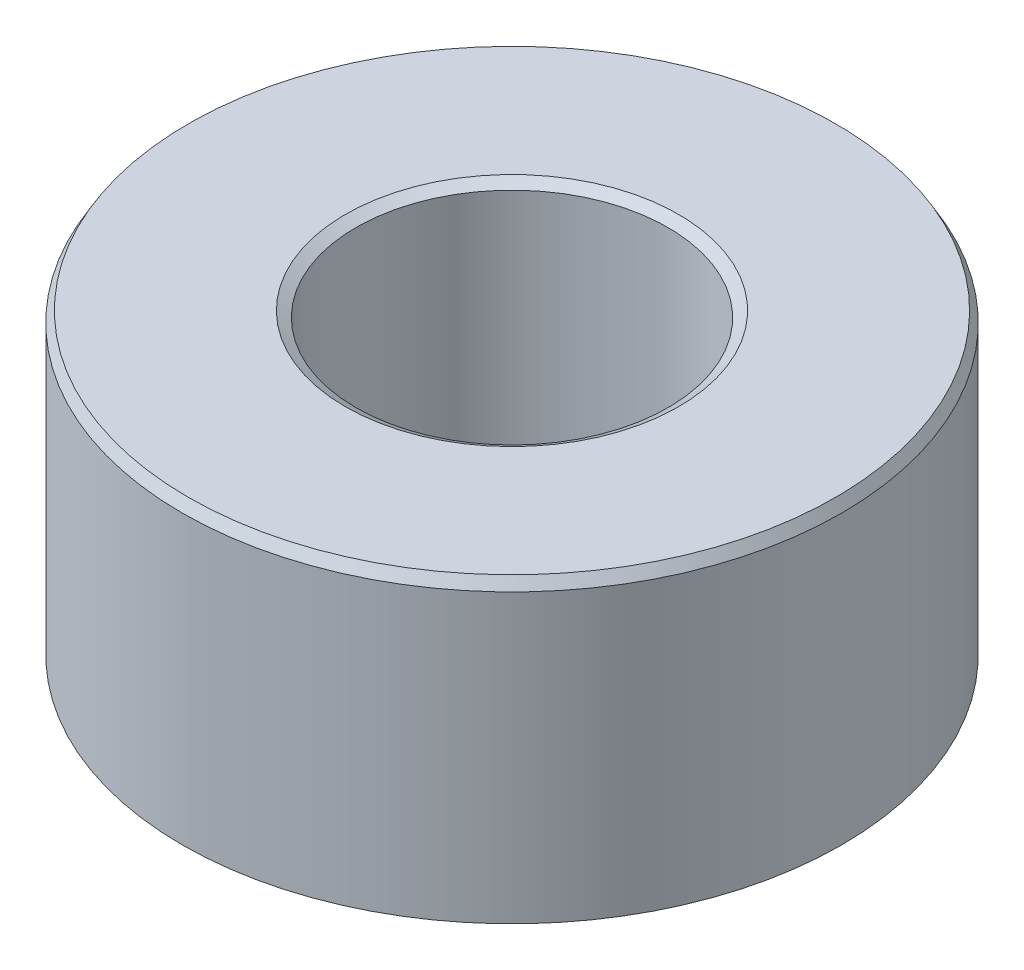
from build123d import *
from OCP.BRepFilletAPI import BRepFilletAPI_MakeChamfer

# Parameters (mm, degrees)
SKETCH1_R           = 7.5
BOSS_EXTRUDE1_DEPTH = 6.916963817
SKETCH2_R           = 3.549956279
CUT_EXTRUDE1_DEPTH  = 13.662716472
CHAMFER1_SIZE       = 0.240414175
CHAMFER1_SIZE2      = 0.138803189


with BuildPart() as part:
    # Sketch1 → Boss-Extrude1 (new body)
    with BuildSketch(Plane(origin=(0, 0, 0), x_dir=(1, 0, 0), z_dir=(0, 1, 0))):
        Circle(SKETCH1_R)
    extrude(amount=BOSS_EXTRUDE1_DEPTH)

    # Sketch2 → Cut-Extrude1 (cut, through all)
    with BuildSketch(Plane(origin=(0, 0, 0), x_dir=(1, 0, 0), z_dir=(0, 1, 0))):
        Circle(SKETCH2_R)
    extrude(amount=CUT_EXTRUDE1_DEPTH, mode=Mode.SUBTRACT)

    # Chamfer1: one chamfer whose edges measure the first distance from different faces: ONE call of the kernel's chamfer builder (chamfer() names one face for all edges)
    chamfer1_edges_1 = [part.edges().sort_by_distance(p)[0] for p in [
        (-3.549956279, 6.916963817, 0),
    ]]
    chamfer1_side_1 = [part.faces().sort_by_distance(p)[0] for p in [
        (-7.287867966, 6.916963817, 0),
    ]]
    chamfer1_edges_2 = [part.edges().sort_by_distance(p)[0] for p in [
        (-3.549956279, 0, 0),
    ]]
    chamfer1_side_2 = [part.faces().sort_by_distance(p)[0] for p in [
        (-3.549956279, 3.458481908, 0),
    ]]
    chamfer1_edges_3 = [part.edges().sort_by_distance(p)[0] for p in [
        (-7.5, 0, 0),
    ]]
    chamfer1_side_3 = [part.faces().sort_by_distance(p)[0] for p in [
        (-7.287867966, 0, 0),
    ]]
    chamfer1_edges_4 = [part.edges().sort_by_distance(p)[0] for p in [
        (-7.5, 6.916963817, 0),
    ]]
    chamfer1_side_4 = [part.faces().sort_by_distance(p)[0] for p in [
        (-7.5, 3.458481908, 0),
    ]]
    chamfer1 = BRepFilletAPI_MakeChamfer(part.part.solid().wrapped)
    for e in chamfer1_edges_1:
        chamfer1.Add(CHAMFER1_SIZE, CHAMFER1_SIZE2, e.wrapped, chamfer1_side_1[0].wrapped)  # the first distance lies on this face
    for e in chamfer1_edges_2:
        chamfer1.Add(CHAMFER1_SIZE, CHAMFER1_SIZE2, e.wrapped, chamfer1_side_2[0].wrapped)  # the first distance lies on this face
    for e in chamfer1_edges_3:
        chamfer1.Add(CHAMFER1_SIZE, CHAMFER1_SIZE2, e.wrapped, chamfer1_side_3[0].wrapped)  # the first distance lies on this face
    for e in chamfer1_edges_4:
        chamfer1.Add(CHAMFER1_SIZE, CHAMFER1_SIZE2, e.wrapped, chamfer1_side_4[0].wrapped)  # the first distance lies on this face
    add(Compound.cast(chamfer1.Shape()), mode=Mode.REPLACE)


solid = part.part
